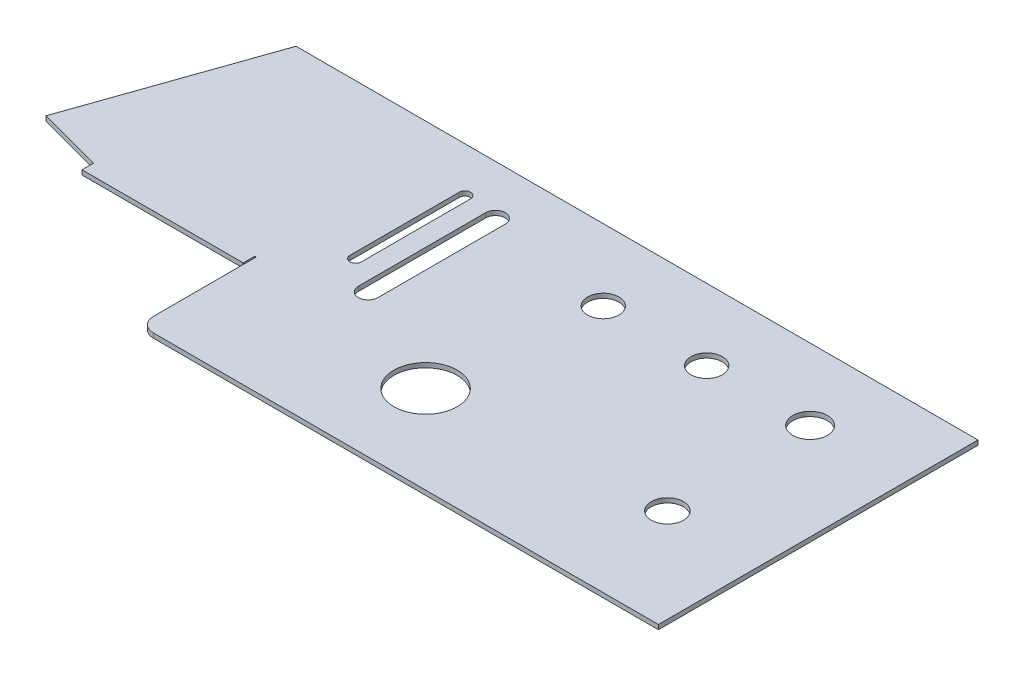
from build123d import *

# Parameters (mm, degrees)
SKETCH2_R           = 5.5
SKETCH2_R_2         = 6.05
SKETCH2_R_3         = 11.1
SKETCH2_R_4         = 5.65
BOSS_EXTRUDE1_DEPTH = 1.6


with BuildPart() as part:
    # Sketch2 → Boss-Extrude1 (new body)
    with BuildSketch(Plane(origin=(0, 0, 0), x_dir=(1, 0, 0), z_dir=(0, 1, 0))):
        with BuildLine():
            Line((-44.872215876, -12.515500752), (-44.372215876, -12.515500752))
            Line((-44.372215876, -12.515500752), (-44.372215876, -48.515500752))
            ThreePointArc((-44.372215876, -48.515500752), (-42.907749781, -52.051034657), (-39.372215876, -53.515500752))
            Line((-39.372215876, -53.515500752), (137.627784124, -53.515500752))
            Line((137.627784124, -53.515500752), (137.627784124, 58.484499248))
            Line((137.627784124, 58.484499248), (-101.372215876, 58.484499248))
            Line((-101.372215876, 58.484499248), (-124.071472793, -6.433253192))
            Line((-124.071472793, -6.433253192), (-101.372215876, -12.515500752))
            Line((-101.372215876, -12.515500752), (-101.372215876, -16.515500752))
            Line((-101.372215876, -16.515500752), (-44.872215876, -16.515500752))
            Line((-44.872215876, -16.515500752), (-44.872215876, -12.515500752))
        make_face()
        with Locations((31.285988016, 33.484499248)):
            Circle(SKETCH2_R, mode=Mode.SUBTRACT)
        with Locations((67.535988016, 33.484499248)):
            Circle(SKETCH2_R, mode=Mode.SUBTRACT)
        with Locations((103.785988016, 33.484499248)):
            Circle(SKETCH2_R_2, mode=Mode.SUBTRACT)
        with Locations((25.177784124, -22.665500752)):
            Circle(SKETCH2_R_3, mode=Mode.SUBTRACT)
        with Locations((104.727784124, -17.465500752)):
            Circle(SKETCH2_R_4, mode=Mode.SUBTRACT)
        with BuildLine():
            Line((-28.472215876, 4.484499248), (-28.472215876, 42.784499248))
            ThreePointArc((-28.472215876, 42.784499248), (-26.472215876, 44.784499248), (-24.472215876, 42.784499248))
            Line((-24.472215876, 42.784499248), (-24.472215876, 4.484499248))
            ThreePointArc((-24.472215876, 4.484499248), (-26.472215876, 2.484499248), (-28.472215876, 4.484499248))
        make_face(mode=Mode.SUBTRACT)
        with BuildLine():
            Line((-10.722215876, 41.184499248), (-10.722215876, -3.415500752))
            ThreePointArc((-10.722215876, -3.415500752), (-14.172215876, -6.865500752), (-17.622215876, -3.415500752))
            Line((-17.622215876, -3.415500752), (-17.622215876, 41.184499248))
            ThreePointArc((-17.622215876, 41.184499248), (-14.172215876, 44.634499248), (-10.722215876, 41.184499248))
        make_face(mode=Mode.SUBTRACT)
    extrude(amount=BOSS_EXTRUDE1_DEPTH)


solid = part.part
